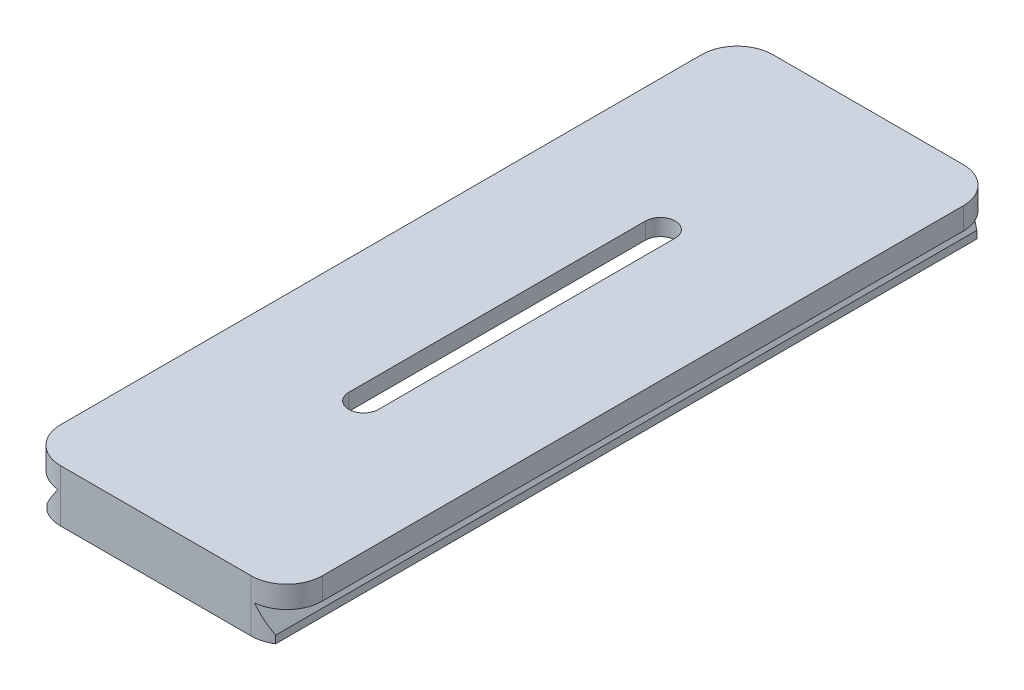
from build123d import *

# Parameters (mm, degrees)
SKETCH1_W           = 44.1
SKETCH1_H           = 120
BOSS_EXTRUDE1_DEPTH = 8.8
FILLET1_R           = 6
CUT_EXTRUDE1_DEPTH  = 123.325968216
CUT_EXTRUDE2_DEPTH  = 6


with BuildPart() as part:
    # Sketch1 → Boss-Extrude1 (new body)
    with BuildSketch(Plane(origin=(0, 0, 0), x_dir=(1, 0, 0), z_dir=(0, 1, 0))):
        Rectangle(SKETCH1_W, SKETCH1_H)
        with BuildLine():
            Line((-2.5, -25), (-2.5, 25))
            ThreePointArc((-2.5, 25), (0, 27.5), (2.5, 25))
            Line((2.5, 25), (2.5, -25))
            ThreePointArc((2.5, -25), (0, -27.5), (-2.5, -25))
        make_face(mode=Mode.SUBTRACT)
    extrude(amount=BOSS_EXTRUDE1_DEPTH)

    # Fillet1
    fillet1_edges = [part.edges().sort_by_distance(p)[0] for p in [
        (-22.05, 4.4, 60),
        (-22.05, 4.4, -60),
        (22.05, 4.4, -60),
        (22.05, 4.4, 60),
    ]]
    fillet(fillet1_edges, radius=FILLET1_R)

    # Sketch2 → Cut-Extrude1 (cut, through all)
    with BuildSketch(Plane.XY.offset(60)):
        Polygon((19.25, 0), (19.25, 1.270336268), (16.65, 4.958404732), (16.65, 5.1), (22.05, 5.1), (22.05, 0), align=None)
        Polygon((-22.05, 0), (-19.25, 0), (-19.25, 1.270336268), (-16.65, 4.958404732), (-16.65, 5.1), (-22.05, 5.1), align=None)
    extrude(amount=-CUT_EXTRUDE1_DEPTH, mode=Mode.SUBTRACT)

    # Sketch3 → Cut-Extrude2 (cut)
    with BuildSketch(Plane.XZ):
        with BuildLine():
            Line((-8.95, -55), (8.95, -55))
            ThreePointArc((8.95, -55), (12.485533906, -53.535533906), (13.95, -50))
            Line((13.95, -50), (13.95, 50))
            ThreePointArc((13.95, 50), (12.485533906, 53.535533906), (8.95, 55))
            Line((8.95, 55), (-8.95, 55))
            ThreePointArc((-8.95, 55), (-12.485533906, 53.535533906), (-13.95, 50))
            Line((-13.95, 50), (-13.95, -50))
            ThreePointArc((-13.95, -50), (-12.485533906, -53.535533906), (-8.95, -55))
        make_face()
    extrude(amount=-CUT_EXTRUDE2_DEPTH, mode=Mode.SUBTRACT)


solid = part.part
